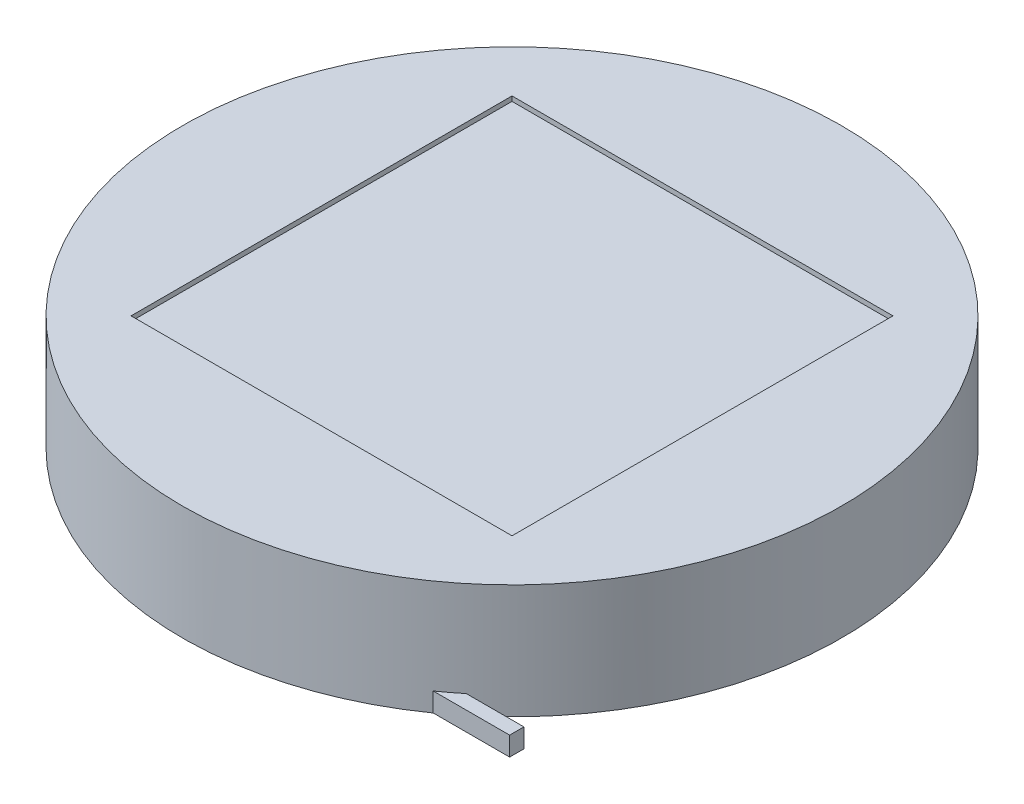
from build123d import *

# Parameters (mm, degrees)
BOSS_EXTRUDE1_DEPTH     = 12
SKETCH4_W               = 40
SKETCH4_H               = 40
CUT_EXTRUDE3_DEPTH      = 0.5
SKETCH1_6_W             = 28
SKETCH1_6_H             = 1.5
EXTRUDE_THIN1_DEPTH     = 2
CUT_EXTRUDE6_DEPTH      = 28
CUT_EXTRUDE6_DEPTH_BACK = 30


with BuildPart() as part:
    # Sketch1 → Boss-Extrude1 (new body)
    with BuildSketch(Plane(origin=(0, 0, 0), x_dir=(1, 0, 0), z_dir=(0, 1, 0))):
        with BuildLine():
            ThreePointArc((-20.997857034, 27.5), (-27.5, -20.997857034), (20.997857034, -27.5))
            ThreePointArc((20.997857034, -27.5), (27.5, 20.997857034), (-20.997857034, 27.5))
        make_face()
    extrude(amount=BOSS_EXTRUDE1_DEPTH)

    # Sketch4 → Cut-Extrude3 (cut)
    with BuildSketch(Plane(origin=(0, 12, 0), x_dir=(1, 0, 0), z_dir=(0, 1, 0))):
        Rectangle(SKETCH4_W, SKETCH4_H)
    extrude(amount=-CUT_EXTRUDE3_DEPTH, mode=Mode.SUBTRACT)

    # Sketch1<6> → Extrude-Thin1 (add)
    with BuildSketch(Plane(origin=(0, 0, 0), x_dir=(1, 0, 0), z_dir=(0, 1, 0))):
        with Locations((-14, 27.5)):
            Rectangle(SKETCH1_6_W, SKETCH1_6_H)
        with Locations((14, -27.5)):
            Rectangle(SKETCH1_6_W, SKETCH1_6_H)
    extrude(amount=EXTRUDE_THIN1_DEPTH)

    # Sketch11 → Cut-Extrude6 (cut, two sides: drawn at the far end of the back side and taken through both)
    with BuildSketch(Plane(origin=(0, 0, 0), x_dir=(0, 0, -1), z_dir=(1, 0, 0)).offset(-CUT_EXTRUDE6_DEPTH_BACK)):
        Polygon((34.6, 0), (34.6, 4.984885974), (29.615114026, 0), align=None)
    extrude(amount=CUT_EXTRUDE6_DEPTH + CUT_EXTRUDE6_DEPTH_BACK, mode=Mode.SUBTRACT)


solid = part.part
